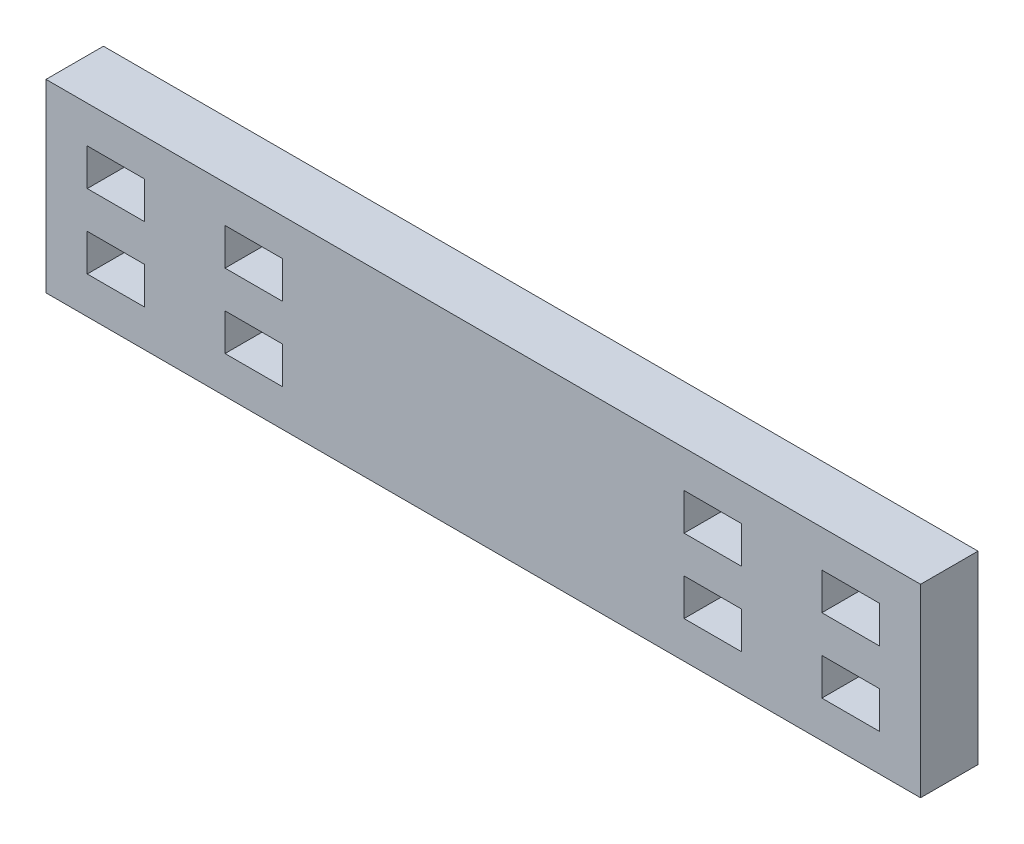
from build123d import *

# Parameters (mm, degrees)
SKETCH1_W           = 78.4
SKETCH1_H           = 16.577
BOSS_EXTRUDE1_DEPTH = 5.15
SKETCH2_W           = 5.15
SKETCH2_H           = 3.3154
CUT_EXTRUDE1_DEPTH  = 81.298688837


with BuildPart() as part:
    # Sketch1 → Boss-Extrude1 (new body)
    with BuildSketch(Plane.XY):
        with Locations((39.2, 8.2885)):
            Rectangle(SKETCH1_W, SKETCH1_H)
    extrude(amount=BOSS_EXTRUDE1_DEPTH)

    # Sketch2 → Cut-Extrude1 (cut, through all)
    with BuildSketch(Plane.XY.offset(5.15)):
        with Locations((6.271959232, 11.6039)):
            Rectangle(SKETCH2_W, SKETCH2_H)
        with Locations((6.271959232, 4.9731)):
            Rectangle(SKETCH2_W, SKETCH2_H)
        with Locations((18.625, 11.6039)):
            Rectangle(SKETCH2_W, SKETCH2_H)
        with Locations((18.625, 4.9731)):
            Rectangle(SKETCH2_W, SKETCH2_H)
        with Locations((59.775, 4.9731)):
            Rectangle(SKETCH2_W, SKETCH2_H)
        with Locations((59.775, 11.6039)):
            Rectangle(SKETCH2_W, SKETCH2_H)
        with Locations((72.128040768, 4.9731)):
            Rectangle(SKETCH2_W, SKETCH2_H)
        with Locations((72.128040768, 11.6039)):
            Rectangle(SKETCH2_W, SKETCH2_H)
    extrude(amount=-CUT_EXTRUDE1_DEPTH, mode=Mode.SUBTRACT)


solid = part.part
